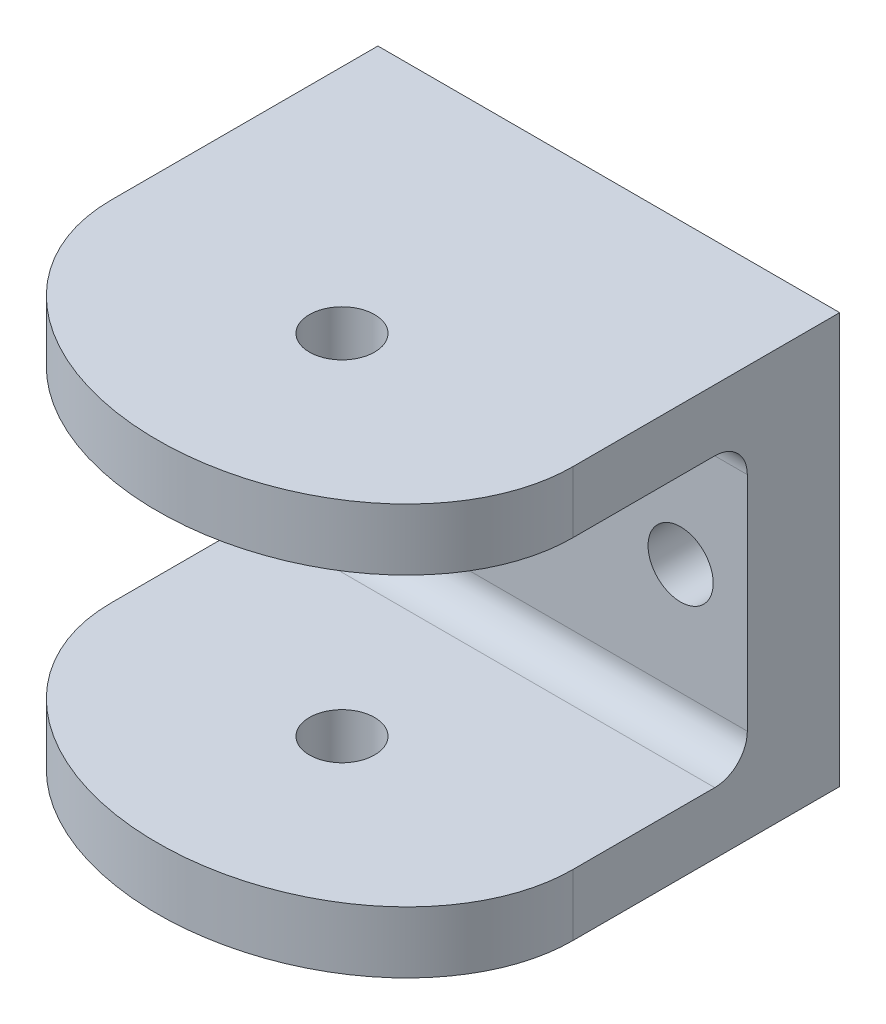
from build123d import *

# Parameters (mm, degrees)
SKETCH1_W           = 45
SKETCH1_H           = 40
SKETCH1_R           = 3.175
BOSS_EXTRUDE1_DEPTH = 9
SKETCH2_W           = 45
SKETCH2_H           = 6
BOSS_EXTRUDE2_DEPTH = 35
FILLET1_R           = 3.175
SKETCH3_R           = 3.175
CUT_EXTRUDE1_DEPTH  = 64.578691399


with BuildPart() as part:
    # Sketch1 → Boss-Extrude1 (new body)
    with BuildSketch(Plane.XY):
        Rectangle(SKETCH1_W, SKETCH1_H)
        with Locations((16, 0)):
            Circle(SKETCH1_R, mode=Mode.SUBTRACT)
        with Locations((-16, 0)):
            Circle(SKETCH1_R, mode=Mode.SUBTRACT)
    extrude(amount=BOSS_EXTRUDE1_DEPTH)

    # Sketch2 → Boss-Extrude2 (add)
    with BuildSketch(Plane.XY.offset(9)):
        with Locations((0, 17)):
            Rectangle(SKETCH2_W, SKETCH2_H)
        with Locations((0, -17)):
            Rectangle(SKETCH2_W, SKETCH2_H)
    extrude(amount=BOSS_EXTRUDE2_DEPTH)

    # Fillet1
    fillet1_edges = [part.edges().sort_by_distance(p)[0] for p in [
        (0, 14, 9),
        (0, -14, 9),
    ]]
    fillet(fillet1_edges, radius=FILLET1_R)

    # Sketch3 → Cut-Extrude1 (cut, through all)
    with BuildSketch(Plane(origin=(0, 20, 0), x_dir=(1, 0, 0), z_dir=(0, 1, 0))):
        with BuildLine():
            Line((9.08e-07, -44), (22.5, -44))
            Line((22.5, -44), (22.5, -26))
            add(Edge.make_bspline(
                [(9.08e-07, -44), (7.181949883, -43.99999957), (13.035725314, -40.671220242), (22.4999996, -35.289312281), (22.5, -26)],
                knots=[1.530551828, 1.530551828, 1.530551828, 2.188746363, 2.188746363, 3.155795213, 3.155795213, 3.155795213], degree=2, weights=[0.772303258, 0.837192571, 1, 0.760796044, 0.732965973]))
        make_face()
        with BuildLine():
            Line((-22.5, -44), (9.08e-07, -44))
            add(Edge.make_bspline(
                [(-22.5, -26.000001723), (-22.499998622, -44.000001347), (9.08e-07, -44)],
                knots=[0, 0, 0, 1.530551828, 1.530551828, 1.530551828], degree=2, weights=[1, 0.621411005, 0.772303258]))
            Line((-22.5, -26.000001723), (-22.5, -44))
        make_face()
        with Locations((0, -26)):
            Circle(SKETCH3_R)
    extrude(amount=-CUT_EXTRUDE1_DEPTH, mode=Mode.SUBTRACT)


solid = part.part
